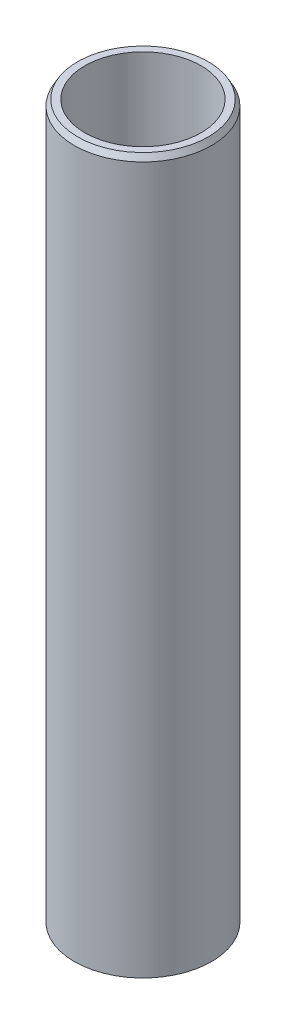
from build123d import *
from OCP.BRepFilletAPI import BRepFilletAPI_MakeChamfer

# Parameters (mm, degrees)
SKETCH1_R           = 57.5
BOSS_EXTRUDE1_DEPTH = 600
SKETCH2_R           = 48.722615626
CUT_EXTRUDE1_DEPTH  = 606.485342515
CHAMFER1_SIZE       = 4.866916263
CHAMFER1_SIZE2      = 2.809915414


with BuildPart() as part:
    # Sketch1 → Boss-Extrude1 (new body)
    with BuildSketch(Plane(origin=(0, 0, 0), x_dir=(1, 0, 0), z_dir=(0, 1, 0))):
        Circle(SKETCH1_R)
    extrude(amount=BOSS_EXTRUDE1_DEPTH)

    # Sketch2 → Cut-Extrude1 (cut, through all)
    with BuildSketch(Plane(origin=(0, 0, 0), x_dir=(1, 0, 0), z_dir=(0, 1, 0))):
        Circle(SKETCH2_R)
    extrude(amount=CUT_EXTRUDE1_DEPTH, mode=Mode.SUBTRACT)

    # Chamfer1: one chamfer whose edges measure the first distance from different faces: ONE call of the kernel's chamfer builder (chamfer() names one face for all edges)
    chamfer1_edges_1 = [part.edges().sort_by_distance(p)[0] for p in [
        (-57.5, 600, 0),
    ]]
    chamfer1_side_1 = [part.faces().sort_by_distance(p)[0] for p in [
        (-57.5, 300, 0),
    ]]
    chamfer1_edges_2 = [part.edges().sort_by_distance(p)[0] for p in [
        (-57.5, 0, 0),
    ]]
    chamfer1_side_2 = [part.faces().sort_by_distance(p)[0] for p in [
        (-55.873654403, 0, 0),
    ]]
    chamfer1 = BRepFilletAPI_MakeChamfer(part.part.solid().wrapped)
    for e in chamfer1_edges_1:
        chamfer1.Add(CHAMFER1_SIZE, CHAMFER1_SIZE2, e.wrapped, chamfer1_side_1[0].wrapped)  # the first distance lies on this face
    for e in chamfer1_edges_2:
        chamfer1.Add(CHAMFER1_SIZE, CHAMFER1_SIZE2, e.wrapped, chamfer1_side_2[0].wrapped)  # the first distance lies on this face
    add(Compound.cast(chamfer1.Shape()), mode=Mode.REPLACE)


solid = part.part
